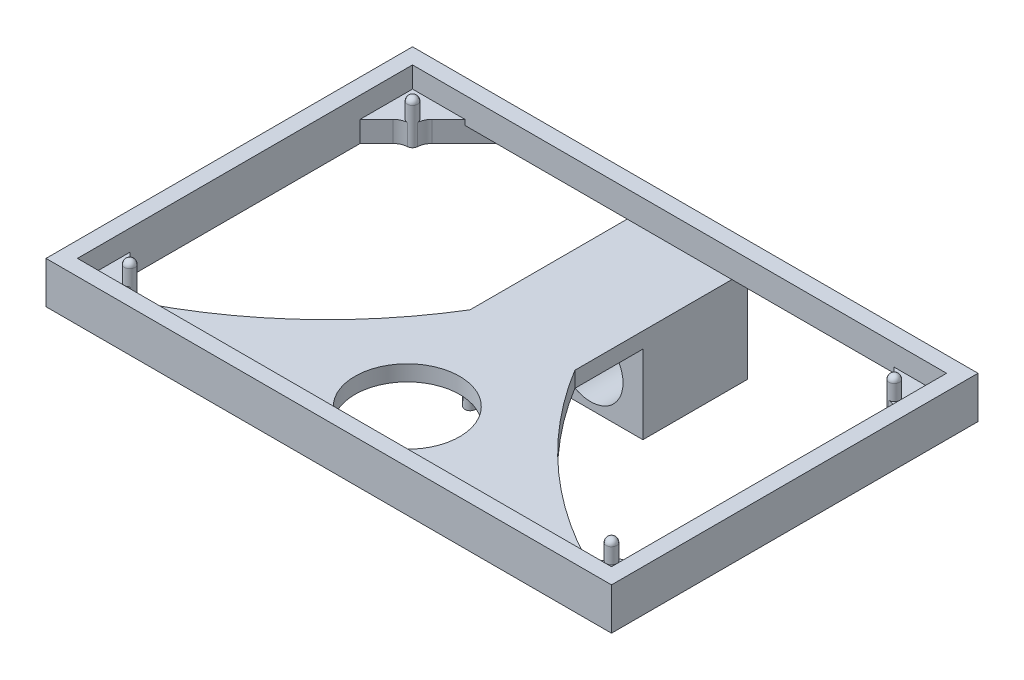
from build123d import *

# Parameters (mm, degrees)
SKETCH_1_W          = 108
SKETCH_1_H          = 70
SKETCH_1_W_2        = 102
SKETCH_1_H_2        = 64
EXTRUDE_1_DEPTH     = 5
EXTRUDE_8_DEPTH     = 3
SKETCH_4_W          = 20
SKETCH_4_H          = 18
EXTRUDE_9_DEPTH     = 20
SKETCH_5_R          = 6.2
CUT_EXTRUDE_1_DEPTH = 76.7627877
FILLET_2_R          = 1
EXTRUDE_10_DEPTH    = 1
EXTRUDE_11_DEPTH    = 3
FILLET_3_R          = 3
SKETCH_8_R          = 10
CUT_EXTRUDE_2_DEPTH = 5
SKETCH_9_R          = 1
EXTRUDE_12_DEPTH    = 4
FILLET_4_R          = 3
FILLET_5_R          = 1
EXTRUDE_13_DEPTH    = 3
SKETCH_12_R         = 1
EXTRUDE_15_DEPTH    = 3


with BuildPart() as part:
    # 草图1 → 凸台-拉伸1 (new body)
    with BuildSketch(Plane(origin=(0, 0, 0), x_dir=(1, 0, 0), z_dir=(0, 1, 0))):
        Rectangle(SKETCH_1_W, SKETCH_1_H)
        Rectangle(SKETCH_1_W_2, SKETCH_1_H_2, mode=Mode.SUBTRACT)
    extrude(amount=EXTRUDE_1_DEPTH)

    # 草图3 → 凸台-拉伸8 (add)
    with BuildSketch(Plane.XZ):
        with BuildLine():
            Line((10, -35), (-10, -35))
            Line((-10, -35), (-10, -2))
            ThreePointArc((-10, -2), (-28.889417714, 19.435738798), (-54, 33.065106234))
            Line((-54, 33.065106234), (-54, 35))
            Line((-54, 35), (54, 35))
            Line((54, 35), (54, 33.065106234))
            ThreePointArc((54, 33.065106234), (28.889417714, 19.435738798), (10, -2))
            Line((10, -2), (10, -35))
        make_face()
    extrude(amount=EXTRUDE_8_DEPTH)

    # 草图4 → 凸台-拉伸9 (add)
    with BuildSketch(Plane(origin=(0, 0, -35), x_dir=(-1, 0, 0), z_dir=(0, 0, -1))):
        with Locations((0, -9)):
            Rectangle(SKETCH_4_W, SKETCH_4_H)
    extrude(amount=-EXTRUDE_9_DEPTH)

    # 草图5 → 切除-拉伸1 (cut, through all)
    with BuildSketch(Plane.XY.offset(-15)):
        with Locations((0, -10.5)):
            Circle(SKETCH_5_R)
    extrude(amount=-CUT_EXTRUDE_1_DEPTH, mode=Mode.SUBTRACT)

    # 圆角2
    # the kernel refuses this fillet: 1 mm, written as the material it adds along each edge
    with BuildSketch(Plane(origin=(-53.5, 0, 32), x_dir=(0, 1, 0), z_dir=(1, 0, 0))) as fillet_2_piece_1:
        with BuildLine():
            CenterArc((FILLET_2_R, -FILLET_2_R), FILLET_2_R, 90, 90)
            Line((0, -FILLET_2_R), (0, 0))
            Line((0, 0), (FILLET_2_R, 0))
        make_face()
    extrude(amount=107)

    # 草图6 → 凸台-拉伸10 (add)
    with BuildSketch(Plane(origin=(0, 0, 0), x_dir=(1, 0, 0), z_dir=(0, 1, 0))):
        Polygon((51, 32), (41, 32), (51, 22), align=None)
        Polygon((-51, 32), (-41, 32), (-51, 22), align=None)
        Polygon((-51, -22), (-51, -32), (-41, -32), align=None)
        Polygon((51, -32), (41, -32), (51, -22), align=None)
    extrude(amount=EXTRUDE_10_DEPTH)

    # 草图7 → 凸台-拉伸11 (add)
    with BuildSketch(Plane.XZ):
        Polygon((38, -35), (54, -19), (54, -35), align=None)
        Polygon((-54, -35), (-38, -35), (-54, -19), align=None)
        Polygon((54, 35), (38, 35), (54, 19), align=None)
        Polygon((-54, 35), (-38, 35), (-54, 19), align=None)
    extrude(amount=EXTRUDE_11_DEPTH)

    # 圆角3
    fillet_3_edges = [part.edges().sort_by_distance(p)[0] for p in [
        (44.013135699, -1.5, 28.986864301),
        (-44.013135699, -1.5, 28.986864301),
    ]]
    fillet(fillet_3_edges, radius=FILLET_3_R)

    # 草图8 → 切除-拉伸2 (cut, symmetric)
    with BuildSketch(Plane(origin=(0, 0, 0), x_dir=(1, 0, 0), z_dir=(0, 1, 0))):
        with Locations(Location((0, -20, 0), (0, 0, 270))):
            Circle(SKETCH_8_R)
    extrude(amount=CUT_EXTRUDE_2_DEPTH, both=True, mode=Mode.SUBTRACT)

    # 草图9 → 凸台-拉伸12 (add, symmetric)
    with BuildSketch(Plane(origin=(0, 1, 0), x_dir=(1, 0, 0), z_dir=(0, 1, 0))):
        with Locations(Location((46, -27, 0), (0, 0, 270))):
            Circle(SKETCH_9_R)
        with Locations(Location((-46, -27, 0), (0, 0, 315))):
            Circle(SKETCH_9_R)
        with Locations(Location((-46, 27, 0), (0, 0, 270))):
            Circle(SKETCH_9_R)
        with Locations(Location((46, 27, 0), (0, 0, 315))):
            Circle(SKETCH_9_R)
    extrude(amount=EXTRUDE_12_DEPTH, both=True)

    # 圆角4
    # the kernel refuses this fillet: 3 mm, written as the material it adds along each edge
    with BuildSketch(Plane(origin=(46.707106781, -3, 26.292893219), x_dir=(0.7071067811865442, 0, -0.7071067811865508), z_dir=(0, 1, 0)), Plane(origin=(-46.707106781, -3, -26.292893219), x_dir=(-0.7071067811865422, 0, 0.707106781186553), z_dir=(0, 1, 0))) as fillet_4_piece_1:
        with BuildLine():
            CenterArc((1.645751311, 3), FILLET_4_R, 228.590377891, 41.409622109)
            ThreePointArc((-0.338562172, 0.75), (-0.088562172, 0.411437828), (0, 0))
            Line((0, 0), (1.645751311, 0))
        make_face()
    extrude(amount=4)
    with BuildSketch(Plane(origin=(-46.707106781, -3, 26.292893219), x_dir=(0.9354143466934858, 0, -0.3535533905932727), z_dir=(0, 1, 0))) as fillet_4_piece_2:
        with BuildLine():
            CenterArc((2.057189139, 2.734313483), FILLET_4_R, 204.295188945, 41.409622109)
            Line((-0.677124344, 1.5), (0, 0))
            ThreePointArc((0, 0), (0.411437828, 0.088562172), (0.822875656, 0))
        make_face()
    extrude(amount=4)
    with BuildSketch(Plane(origin=(-45.292893219, -3, -27.707106781), x_dir=(0.7071067811865529, 0, -0.7071067811865421), z_dir=(0, 1, 0)), Plane(origin=(46.707106781, -3, -26.292893219), x_dir=(0.7071067811865476, 0, 0.7071067811865476), z_dir=(0, 1, 0))) as fillet_4_piece_3:
        with BuildLine():
            CenterArc((1.645751311, -3), FILLET_4_R, 90, 41.409622109)
            ThreePointArc((-0.338562172, -0.75), (-0.088562172, -0.411437828), (0, 0))
            Line((0, 0), (1.645751311, 0))
        make_face()
    extrude(amount=4)
    with BuildSketch(Plane(origin=(45.292893219, -3, -27.707106781), x_dir=(-0.35355339059328167, 0, 0.9354143466934823), z_dir=(0, 1, 0))) as fillet_4_piece_4:
        with BuildLine():
            CenterArc((2.057189139, -2.734313483), FILLET_4_R, 114.295188945, 41.409622109)
            Line((-0.677124344, -1.5), (0, 0))
            ThreePointArc((0, 0), (0.411437828, -0.088562172), (0.822875656, 0))
        make_face()
    extrude(amount=4)

    # 圆角5
    fillet_5_edges = [part.edges().sort_by_distance(p)[0] for p in [
        (46, 5, 26),
        (-46.707106781, 5, 26.292893219),
        (-46, 5, -28),
        (45.292893219, 5, -27.707106781),
    ]]
    fillet(fillet_5_edges, radius=FILLET_5_R)

    # 草图10 → 凸台-拉伸13 (add)
    with BuildSketch(Plane.XZ):
        Polygon((-51, 22), (-54, 19), (-54, -19), (-51, -22), align=None)
        Polygon((54, -19), (51, -22), (51, 22), (54, 19), align=None)
    extrude(amount=EXTRUDE_13_DEPTH)

    # 草图12 → 凸台-拉伸15 (add)
    with BuildSketch(Plane.XZ.offset(3)):
        with Locations(Location((0, -8, 0), (0, 0, 90))):
            Circle(SKETCH_12_R)
        with Locations(Location((0, 8, 0), (0, 0, 90))):
            Circle(SKETCH_12_R)
    extrude(amount=EXTRUDE_15_DEPTH)


solid = part.part
